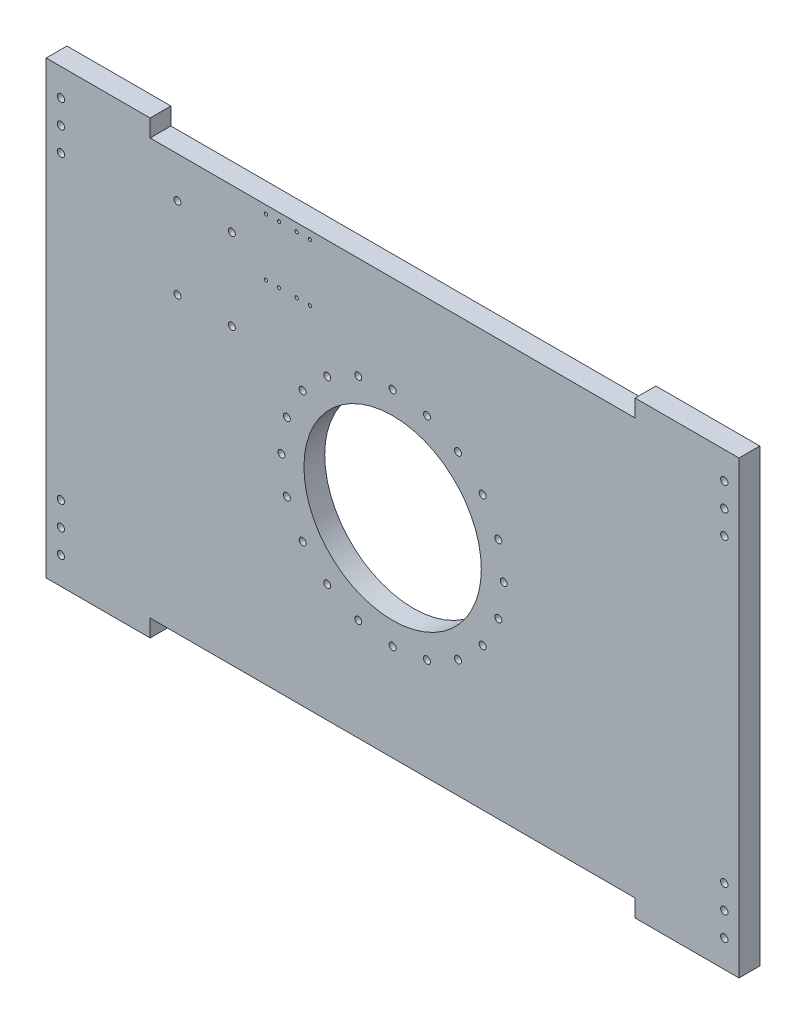
from build123d import *

# Parameters (mm, degrees)
BOSS_EXTRU_1_DEPTH           = 60
ESQUISSE2_R                  = 256
ENL_V_MAT_EXTRU_1_DEPTH      = 1602.905115792
ESQUISSE5_R                  = 10
ENL_V_MAT_EXTRU_3_DEPTH      = 1602.905115792
R_P_TITION_CIRCULAIRE1_COUNT = 20
ESQUISSE6_R                  = 10.5
ENL_V_MAT_EXTRU_4_DEPTH      = 1602.905115792
ENL_V_MAT_EXTRU_5_DEPTH      = 1602.905115792
ENL_V_MAT_EXTRU_5_DEPTH_BACK = 100
ESQUISSE11_R                 = 10
ESQUISSE12_R                 = 4.7625
ESQUISSE12_R_2               = 4.764130996
ENL_V_MAT_EXTRU_6_DEPTH      = 100


with BuildPart() as part:
    # Esquisse1 → Boss.-Extru.1 (new body)
    with BuildSketch(Plane.XY):
        Polygon((-1000, 1250), (-700, 1250), (-700, 1200), (700, 1200), (700, 1250), (1000, 1250), (1000, -50), (700, -50), (700, 0), (-700, 0), (-700, -50), (-1000, -50), align=None)
    extrude(amount=BOSS_EXTRU_1_DEPTH)

    # Esquisse2 → Enlèv. mat.-Extru.1 (cut, through all)
    with BuildSketch(Plane.XY.offset(60)):
        with Locations((0, 600)):
            Circle(ESQUISSE2_R)
    extrude(amount=-ENL_V_MAT_EXTRU_1_DEPTH, mode=Mode.SUBTRACT)

    # Esquisse5 → Enlèv. mat.-Extru.3 (cut, through all)
    with BuildSketch(Plane.XY):
        with Locations((0, 921)):
            Circle(ESQUISSE5_R)
    enl_v_mat_extru_3 = extrude(amount=ENL_V_MAT_EXTRU_3_DEPTH, mode=Mode.SUBTRACT)

    # Répétition circulaire1: Enlèv. mat.-Extru.3 ×20 about axis
    r_p_tition_circulaire1_axis = Axis((0, 600, 0), (0, 0, -1))
    for i in range(1, R_P_TITION_CIRCULAIRE1_COUNT):
        add(enl_v_mat_extru_3.rotate(r_p_tition_circulaire1_axis, i * 360 / R_P_TITION_CIRCULAIRE1_COUNT), mode=Mode.SUBTRACT)

    # Esquisse6 → Enlèv. mat.-Extru.4 (cut, through all)
    with BuildSketch(Plane(origin=(0, 0, 0), x_dir=(-1, 0, 0), z_dir=(0, 0, -1))):
        with Locations((-957.5, 28.75)):
            Circle(ESQUISSE6_R)
        with Locations((-957.5, 1171.25)):
            Circle(ESQUISSE6_R)
        with Locations((957.5, 1171.25)):
            Circle(ESQUISSE6_R)
        with Locations((957.5, 28.75)):
            Circle(ESQUISSE6_R)
        with Locations((-957.5, 97.5)):
            Circle(ESQUISSE6_R)
        with Locations((-957.5, 166.25)):
            Circle(ESQUISSE6_R)
        with Locations((-957.5, 1033.75)):
            Circle(ESQUISSE6_R)
        with Locations((-957.5, 1102.5)):
            Circle(ESQUISSE6_R)
        with Locations((957.5, 97.5)):
            Circle(ESQUISSE6_R)
        with Locations((957.5, 166.25)):
            Circle(ESQUISSE6_R)
        with Locations((957.5, 1102.5)):
            Circle(ESQUISSE6_R)
        with Locations((957.5, 1033.75)):
            Circle(ESQUISSE6_R)
    extrude(amount=-ENL_V_MAT_EXTRU_4_DEPTH, mode=Mode.SUBTRACT)

    # Esquisse11 → Enlèv. mat.-Extru.5 (cut, two sides: drawn at the far end of the back side and taken through both)
    with BuildSketch(Plane(origin=(0, 0, 0), x_dir=(-1, 0, 0), z_dir=(0, 0, -1)).offset(-ENL_V_MAT_EXTRU_5_DEPTH_BACK)):
        with Locations((464, 847.499999527)):
            Circle(ESQUISSE11_R)
        with Locations((621, 847.499999527)):
            Circle(ESQUISSE11_R)
        with Locations((621, 1082.5)):
            Circle(ESQUISSE11_R)
        with Locations((464, 1082.5)):
            Circle(ESQUISSE11_R)
    extrude(amount=ENL_V_MAT_EXTRU_5_DEPTH + ENL_V_MAT_EXTRU_5_DEPTH_BACK, mode=Mode.SUBTRACT)

    # Esquisse12 → Enlèv. mat.-Extru.6 (cut)
    with BuildSketch(Plane(origin=(0, 0, 0), x_dir=(-1, 0, 0), z_dir=(0, 0, -1))):
        with Locations((238.748120078, 1177.125064527)):
            Circle(ESQUISSE12_R)
        with Locations((327.648120078, 1177.125064527)):
            Circle(ESQUISSE12_R)
        with Locations((238.748120078, 1012.025064527)):
            Circle(ESQUISSE12_R)
        with Locations((276.848120078, 1012.025064527)):
            Circle(ESQUISSE12_R)
        with Locations((327.648120078, 1012.025064527)):
            Circle(ESQUISSE12_R_2)
        with Locations((365.748120078, 1012.025064527)):
            Circle(ESQUISSE12_R)
        with Locations((365.748120078, 1177.125064527)):
            Circle(ESQUISSE12_R)
        with Locations((276.848120078, 1177.125064527)):
            Circle(ESQUISSE12_R)
    extrude(amount=-ENL_V_MAT_EXTRU_6_DEPTH, mode=Mode.SUBTRACT)


solid = part.part
